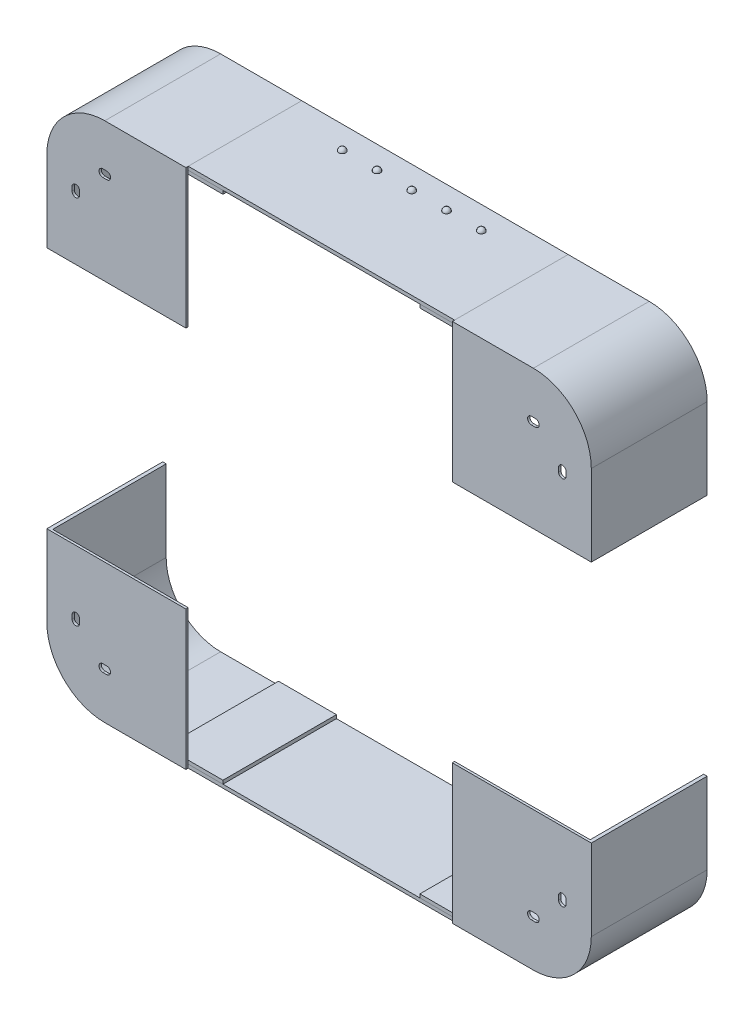
from build123d import *

# Parameters (mm, degrees)
EXTRUDE_THIN1_DEPTH     = 100
BOSS_EXTRUDE1_START     = -2
BOSS_EXTRUDE1_DEPTH     = 2
CUT_EXTRUDE3_DEPTH      = 10
CUT_EXTRUDE4_DEPTH      = 518.421491629
CUT_EXTRUDE4_DEPTH_BACK = 518.421491629
SKETCH7_W               = 230
SKETCH7_H               = 100
CUT_EXTRUDE5_DEPTH      = 535.906533892
CUT_EXTRUDE5_DEPTH_BACK = 535.906533892
SKETCH5_W               = 210
SKETCH5_H               = 554.388763444
SKETCH9_W               = 50
SKETCH9_H               = 98
BOSS_EXTRUDE2_DEPTH     = 3
BOSS_EXTRUDE2_2_DEPTH   = 3
SKETCH10_W              = 230
SKETCH10_H              = 98
BOSS_EXTRUDE3_DEPTH     = 3
SKETCH11_R              = 3
BOSS_EXTRUDE4_DEPTH     = 6
FILLET1_R               = 3
SKETCH12_R              = 3
BOSS_EXTRUDE5_DEPTH     = 6
FILLET2_R               = 3


with BuildPart() as part:
    # Sketch1 → Extrude-Thin1 (new body)
    with BuildSketch(Plane.XY):
        with BuildLine():
            Line((-235, 175), (-235, -175))
            ThreePointArc((-235, -175), (-220.355339059, -210.355339059), (-185, -225))
            Line((-185, -225), (185, -225))
            ThreePointArc((185, -225), (220.355339059, -210.355339059), (235, -175))
            Line((235, -175), (235, 175))
            ThreePointArc((235, 175), (220.355339059, 210.355339059), (185, 225))
            Line((185, 225), (-185, 225))
            ThreePointArc((-185, 225), (-220.355339059, 210.355339059), (-235, 175))
        make_face()
        with BuildLine():
            Line((-232, 175), (-232, -175))
            ThreePointArc((-232, -175), (-218.234018716, -208.234018716), (-185, -222))
            Line((-185, -222), (185, -222))
            ThreePointArc((185, -222), (218.234018716, -208.234018716), (232, -175))
            Line((232, -175), (232, 175))
            ThreePointArc((232, 175), (218.234018716, 208.234018716), (185, 222))
            Line((185, 222), (-185, 222))
            ThreePointArc((-185, 222), (-218.234018716, 208.234018716), (-232, 175))
        make_face(mode=Mode.SUBTRACT)
    extrude(amount=EXTRUDE_THIN1_DEPTH)

    # Sketch2 → Boss-Extrude1 (add)
    with BuildSketch(Plane.XY.offset(100).offset(BOSS_EXTRUDE1_START)):
        with BuildLine():
            Line((0, -222), (0, 222))
            Line((0, 222), (-185, 222))
            ThreePointArc((-185, 222), (-218.234018716, 208.234018716), (-232, 175))
            Line((-232, 175), (-232, -175))
            ThreePointArc((-232, -175), (-218.234018716, -208.234018716), (-185, -222))
            Line((-185, -222), (0, -222))
        make_face()
        with BuildLine():
            Line((185, 222), (0, 222))
            Line((0, 222), (0, -222))
            Line((0, -222), (185, -222))
            ThreePointArc((185, -222), (218.234018716, -208.234018716), (232, -175))
            Line((232, -175), (232, 175))
            ThreePointArc((232, 175), (218.234018716, 208.234018716), (185, 222))
        make_face()
    extrude(amount=BOSS_EXTRUDE1_DEPTH)

    # Sketch6 → Cut-Extrude3 (cut)
    with BuildSketch(Plane.XY.offset(100)):
        with BuildLine():
            Line((-186.75, -181.75), (-183.25, -181.75))
            ThreePointArc((-183.25, -181.75), (-180, -185), (-183.25, -188.25))
            Line((-183.25, -188.25), (-186.75, -188.25))
            ThreePointArc((-186.75, -188.25), (-190, -185), (-186.75, -181.75))
        make_face()
        with BuildLine():
            Line((-213.25, -161.75), (-213.25, -158.25))
            ThreePointArc((-213.25, -158.25), (-210, -155), (-206.75, -158.25))
            Line((-206.75, -158.25), (-206.75, -161.75))
            ThreePointArc((-206.75, -161.75), (-210, -165), (-213.25, -161.75))
        make_face()
        with BuildLine():
            Line((206.75, -161.75), (206.75, -158.25))
            ThreePointArc((206.75, -158.25), (210, -155), (213.25, -158.25))
            Line((213.25, -158.25), (213.25, -161.75))
            ThreePointArc((213.25, -161.75), (210, -165), (206.75, -161.75))
        make_face()
        with BuildLine():
            Line((186.75, -188.25), (183.25, -188.25))
            ThreePointArc((183.25, -188.25), (180, -185), (183.25, -181.75))
            Line((183.25, -181.75), (186.75, -181.75))
            ThreePointArc((186.75, -181.75), (190, -185), (186.75, -188.25))
        make_face()
        with BuildLine():
            Line((186.75, 181.75), (183.25, 181.75))
            ThreePointArc((183.25, 181.75), (180, 185), (183.25, 188.25))
            Line((183.25, 188.25), (186.75, 188.25))
            ThreePointArc((186.75, 188.25), (190, 185), (186.75, 181.75))
        make_face()
        with BuildLine():
            Line((213.25, 161.75), (213.25, 158.25))
            ThreePointArc((213.25, 158.25), (210, 155), (206.75, 158.25))
            Line((206.75, 158.25), (206.75, 161.75))
            ThreePointArc((206.75, 161.75), (210, 165), (213.25, 161.75))
        make_face()
        with BuildLine():
            Line((-206.75, 161.75), (-206.75, 158.25))
            ThreePointArc((-206.75, 158.25), (-210, 155), (-213.25, 158.25))
            Line((-213.25, 158.25), (-213.25, 161.75))
            ThreePointArc((-213.25, 161.75), (-210, 165), (-206.75, 161.75))
        make_face()
        with BuildLine():
            Line((-186.75, 188.25), (-183.25, 188.25))
            ThreePointArc((-183.25, 188.25), (-180, 185), (-183.25, 181.75))
            Line((-183.25, 181.75), (-186.75, 181.75))
            ThreePointArc((-186.75, 181.75), (-190, 185), (-186.75, 188.25))
        make_face()
    extrude(amount=-CUT_EXTRUDE3_DEPTH, mode=Mode.SUBTRACT)

    # Sketch7 → Cut-Extrude4 (cut, two sides: drawn at the far end of the back side and taken through both)
    with BuildSketch(Plane.XZ.offset(225).offset(-CUT_EXTRUDE4_DEPTH_BACK)):
        with Locations((0, 50)):
            Rectangle(SKETCH7_W, SKETCH7_H)
    extrude(amount=CUT_EXTRUDE4_DEPTH + CUT_EXTRUDE4_DEPTH_BACK, mode=Mode.SUBTRACT)


with BuildPart() as cut_extrude4_piece_1:
    # of the separate pieces the step leaves, piece 1, a body of its own (cut_extrude4_pieces)
    add(part.part.solids().sort_by_distance((-235, 175, 0))[0])


with BuildPart() as cut_extrude4_piece_2:
    # of the separate pieces the step leaves, piece 2, a body of its own (cut_extrude4_pieces)
    add(part.part.solids().sort_by_distance((185, 225, 0))[0])


with BuildPart() as cut_extrude5_tool:
    # Sketch5 → Cut-Extrude5 (new, two sides: drawn at the far end of the back side and taken through both)
    with BuildSketch(Plane(origin=(235, -10, 0), x_dir=(0, -1, 0), z_dir=(-1, 0, 0)).offset(-CUT_EXTRUDE5_DEPTH_BACK)):
        with Locations((-10, -119.520343504)):
            Rectangle(SKETCH5_W, SKETCH5_H)
    extrude(amount=CUT_EXTRUDE5_DEPTH + CUT_EXTRUDE5_DEPTH_BACK)


with BuildPart() as cut_extrude4_piece_1_1:
    add(cut_extrude4_piece_1.part)

    # Cut-Extrude5: cut by cut_extrude5_tool
    add(cut_extrude5_tool.part, mode=Mode.SUBTRACT)


with BuildPart() as cut_extrude4_piece_2_1:
    add(cut_extrude4_piece_2.part)

    # Cut-Extrude5: cut by cut_extrude5_tool
    add(cut_extrude5_tool.part, mode=Mode.SUBTRACT)


with BuildPart() as cut_extrude5_piece_1:
    # of the separate pieces the step leaves, piece 1, a body of its own (cut_extrude5_pieces)
    add(cut_extrude4_piece_1_1.part.solids().sort_by_distance((-235, -105, 0))[0])


with BuildPart() as cut_extrude5_piece_2:
    # of the separate pieces the step leaves, piece 2, a body of its own (cut_extrude5_pieces)
    add(cut_extrude4_piece_1_1.part.solids().sort_by_distance((-235, 175, 0))[0])


with BuildPart() as cut_extrude5_piece_1_of_cut_extrude4_pie:
    # of the separate pieces the step leaves, piece 1, a body of its own (cut_extrude5_pieces_of_cut_extrude4_piec)
    add(cut_extrude4_piece_2_1.part.solids().sort_by_distance((235, -175, 0))[0])


with BuildPart() as cut_extrude5_piece_2_of_cut_extrude4_pie:
    # of the separate pieces the step leaves, piece 2, a body of its own (cut_extrude5_pieces_of_cut_extrude4_piec)
    add(cut_extrude4_piece_2_1.part.solids().sort_by_distance((235, 175, 0))[0])


with BuildPart() as body_5:
    # Sketch9 → Boss-Extrude2 (new body)
    with BuildSketch(Plane.XZ.offset(-222)):
        with Locations((-110, 49)):
            Rectangle(SKETCH9_W, SKETCH9_H)
    extrude(amount=BOSS_EXTRUDE2_DEPTH)


with BuildPart() as body_6:
    # Sketch9 → Boss-Extrude2 2 (new body)
    with BuildSketch(Plane.XZ.offset(-222)):
        with Locations((110, 49)):
            Rectangle(SKETCH9_W, SKETCH9_H)
    extrude(amount=BOSS_EXTRUDE2_2_DEPTH)


with BuildPart() as body_7:
    # Sketch10 → Boss-Extrude3 (new body)
    with BuildSketch(Plane(origin=(0, 222, 0), x_dir=(1, 0, 0), z_dir=(0, 1, 0))):
        with Locations((0, -49)):
            Rectangle(SKETCH10_W, SKETCH10_H)
    extrude(amount=BOSS_EXTRUDE3_DEPTH)


with BuildPart() as body_8:
    # Mirror2: mirrored copy
    add(body_5.part.mirror(Plane.ZX))


with BuildPart() as body_9:
    # Mirror2 2: mirrored copy
    add(body_6.part.mirror(Plane.ZX))


with BuildPart() as body_10:
    # Mirror2 3: mirrored copy
    add(body_7.part.mirror(Plane.ZX))

    # Sketch11 → Boss-Extrude4 (add)
    with BuildSketch(Plane.XZ.offset(225)):
        with Locations((-60, 20)):
            Circle(SKETCH11_R)
        with Locations((60, 20)):
            Circle(SKETCH11_R)
        with Locations((0, 20)):
            Circle(SKETCH11_R)
        with Locations((-30, 20)):
            Circle(SKETCH11_R)
        with Locations((30, 20)):
            Circle(SKETCH11_R)
    extrude(amount=BOSS_EXTRUDE4_DEPTH)

    # Fillet1
    fillet1_edges = [body_10.edges().sort_by_distance(p)[0] for p in [
        (-63, -231, 20),
        (57, -231, 20),
        (-3, -231, 20),
        (-33, -231, 20),
        (27, -231, 20),
    ]]
    fillet(fillet1_edges, radius=FILLET1_R)


with BuildPart() as body_7_1:
    add(body_7.part)

    # Sketch12 → Boss-Extrude5 (add)
    with BuildSketch(Plane.XZ.offset(-222)):
        with Locations(Location((-60, 20, 0), (0, 0, 180))):
            Circle(SKETCH12_R)
        with Locations(Location((60, 20, 0), (0, 0, 180))):
            Circle(SKETCH12_R)
        with Locations(Location((30, 20, 0), (0, 0, 180))):
            Circle(SKETCH12_R)
        with Locations(Location((0, 20, 0), (0, 0, 180))):
            Circle(SKETCH12_R)
        with Locations(Location((-30, 20, 0), (0, 0, 180))):
            Circle(SKETCH12_R)
    extrude(amount=-BOSS_EXTRUDE5_DEPTH)

    # Fillet2
    fillet2_edges = [body_7_1.edges().sort_by_distance(p)[0] for p in [
        (-57, 228, 20),
        (63, 228, 20),
        (33, 228, 20),
        (3, 228, 20),
        (-27, 228, 20),
    ]]
    fillet(fillet2_edges, radius=FILLET2_R - 0.0001)  # a hair under: the kernel refuses the full size


solid = Compound([cut_extrude5_piece_1.part, cut_extrude5_piece_2.part, cut_extrude5_piece_1_of_cut_extrude4_pie.part, cut_extrude5_piece_2_of_cut_extrude4_pie.part, body_5.part, body_6.part, body_8.part, body_9.part, body_10.part, body_7_1.part])
